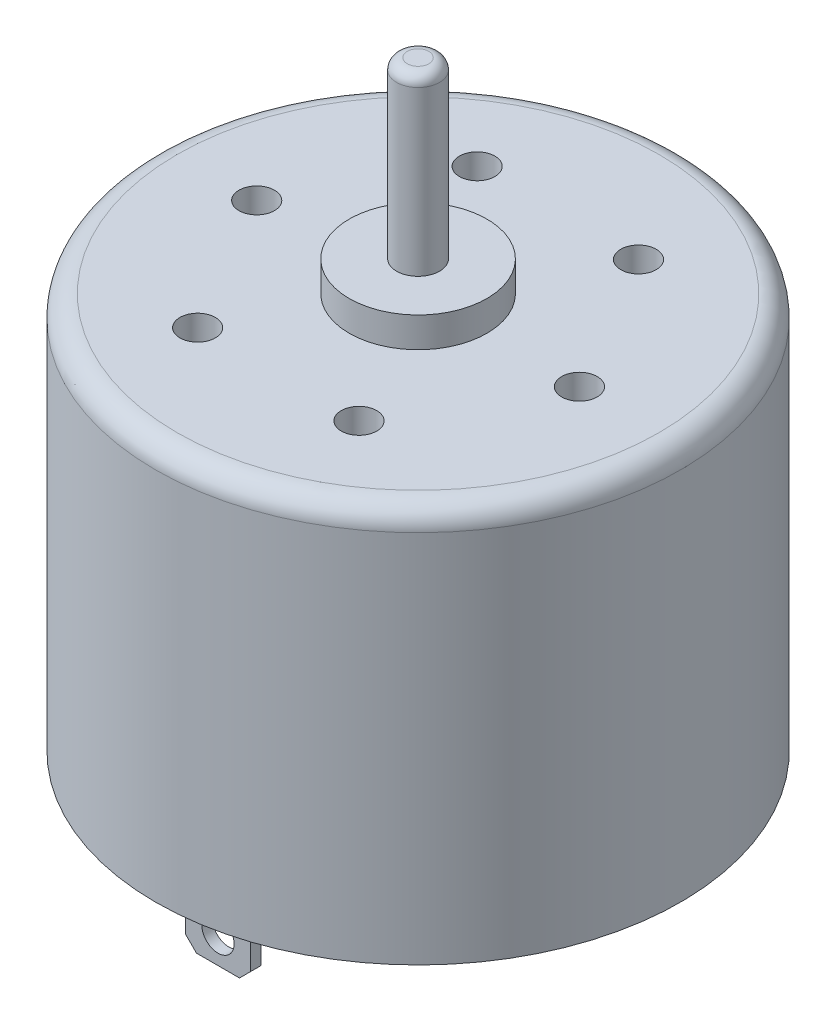
from build123d import *

# Parameters (mm, degrees)
SKETCH1_R                  = 12.2
BOSS_EXTRUDE1_DEPTH        = 18.4
FILLET1_R                  = 1
M2X0_35_TAPPED_HOLE1_D     = 1.65
M2X0_35_TAPPED_HOLE1_DEPTH = 3.05
M2X0_35_TAPPED_HOLE1_TIP   = 0.495710011
SKETCH5_R                  = 3.2
BOSS_EXTRUDE2_DEPTH        = 1.4
SKETCH6_R                  = 1
BOSS_EXTRUDE3_DEPTH        = 8.1
FILLET2_R                  = 0.5
SKETCH8_R                  = 11.9
CUT_EXTRUDE1_DEPTH         = 0.6
SKETCH9_R                  = 3.225
BOSS_EXTRUDE4_DEPTH        = 1.7
FILLET3_R                  = 0.5
BOSS_EXTRUDE5_DEPTH        = 0.5
FILLET4_R                  = 0.5
SKETCH12_R                 = 0.75
BOSS_EXTRUDE6_DEPTH        = 0.25


with BuildPart() as part:
    # Sketch1 → Boss-Extrude1 (new body)
    with BuildSketch(Plane(origin=(0, 0, 0), x_dir=(1, 0, 0), z_dir=(0, 1, 0))):
        with Locations(Location((0, 0, 0), (0, 0, 270))):
            Circle(SKETCH1_R)
    extrude(amount=BOSS_EXTRUDE1_DEPTH)

    # Fillet1
    fillet1_edges = [part.edges().sort_by_distance(p)[0] for p in [
        (0, 18.4, -12.2),
    ]]
    fillet(fillet1_edges, radius=FILLET1_R)

    # M2x0.35 Tapped Hole1
    with Locations(Plane(origin=(0, 18.4, 0), x_dir=(1, 0, 0), z_dir=(0, 1, 0))):
        with Locations((-7.5, 0), (-3.75, 6.495190528), (3.75, 6.495190528), (7.5, 0), (3.75, -6.495190528), (-3.75, -6.495190528)):
            Hole(M2X0_35_TAPPED_HOLE1_D / 2, depth=M2X0_35_TAPPED_HOLE1_DEPTH)
            with Locations((0, 0, -(M2X0_35_TAPPED_HOLE1_DEPTH + M2X0_35_TAPPED_HOLE1_TIP / 2))):  # 118° drill point
                Cone(0, M2X0_35_TAPPED_HOLE1_D / 2, M2X0_35_TAPPED_HOLE1_TIP, mode=Mode.SUBTRACT)

    # Sketch5 → Boss-Extrude2 (add)
    with BuildSketch(Plane(origin=(0, 18.4, 0), x_dir=(1, 0, 0), z_dir=(0, 1, 0))):
        with Locations(Location((0, 0, 0), (0, 0, 270))):
            Circle(SKETCH5_R)
    extrude(amount=BOSS_EXTRUDE2_DEPTH)

    # Sketch6 → Boss-Extrude3 (add)
    with BuildSketch(Plane(origin=(0, 19.8, 0), x_dir=(1, 0, 0), z_dir=(0, 1, 0))):
        with Locations(Location((0, 0, 0), (0, 0, 270))):
            Circle(SKETCH6_R)
    extrude(amount=BOSS_EXTRUDE3_DEPTH)

    # Fillet2
    fillet2_edges = [part.edges().sort_by_distance(p)[0] for p in [
        (0, 27.9, -1),
    ]]
    fillet(fillet2_edges, radius=FILLET2_R)

    # Sketch8 → Cut-Extrude1 (cut)
    with BuildSketch(Plane.XZ):
        with Locations(Location((0, 0, 0), (0, 0, 270))):
            Circle(SKETCH8_R)
    extrude(amount=-CUT_EXTRUDE1_DEPTH, mode=Mode.SUBTRACT)

    # Sketch9 → Boss-Extrude4 (add)
    with BuildSketch(Plane.XZ.offset(-0.6)):
        with Locations(Location((0, 0, 0), (0, 0, 270))):
            Circle(SKETCH9_R)
    extrude(amount=BOSS_EXTRUDE4_DEPTH)

    # Fillet3
    fillet3_edges = [part.edges().sort_by_distance(p)[0] for p in [
        (0, -1.1, 3.225),
    ]]
    fillet(fillet3_edges, radius=FILLET3_R)

    # Sketch11 → Boss-Extrude5 (add)
    with BuildSketch(Plane.XZ.offset(-0.6)):
        with BuildLine():
            Line((-1.95, 10.3), (1.95, 10.3))
            ThreePointArc((1.95, 10.3), (3.2, 9.05), (1.95, 7.8))
            Line((1.95, 7.8), (-1.95, 7.8))
            ThreePointArc((-1.95, 7.8), (-3.2, 9.05), (-1.95, 10.3))
        make_face()
        with BuildLine():
            Line((-1.95, -10.3), (1.95, -10.3))
            ThreePointArc((1.95, -10.3), (3.2, -9.05), (1.95, -7.8))
            Line((1.95, -7.8), (-1.95, -7.8))
            ThreePointArc((-1.95, -7.8), (-3.2, -9.05), (-1.95, -10.3))
        make_face()
    extrude(amount=BOSS_EXTRUDE5_DEPTH)

    # Fillet4
    fillet4_edges = [part.edges().sort_by_distance(p)[0] for p in [
        (0, 0.1, -7.8),
        (3.2, 0.1, -9.05),
        (0, 0.1, -10.3),
        (-3.2, 0.1, -9.05),
        (0, 0.1, 10.3),
        (3.2, 0.1, 9.05),
        (0, 0.1, 7.8),
        (-3.2, 0.1, 9.05),
    ]]
    fillet(fillet4_edges, radius=FILLET4_R - 0.0001)  # a hair under: the kernel refuses the full size

    # Sketch12 → Boss-Extrude6 (add, symmetric)
    with BuildSketch(Plane(origin=(0, 0, 9.05), x_dir=(-1, 0, 0), z_dir=(0, 0, -1))):
        Polygon((-1.5, 0.1), (-1.5, -3.5), (-1, -4), (1, -4), (1.5, -3.5), (1.5, 0.1), align=None)
        with Locations((0, -2.75)):
            Circle(SKETCH12_R, mode=Mode.SUBTRACT)
    boss_extrude6 = extrude(amount=BOSS_EXTRUDE6_DEPTH, both=True)

    # Mirror4: Boss-Extrude6 across plane
    add(boss_extrude6.mirror(Plane.XY))


solid = part.part
